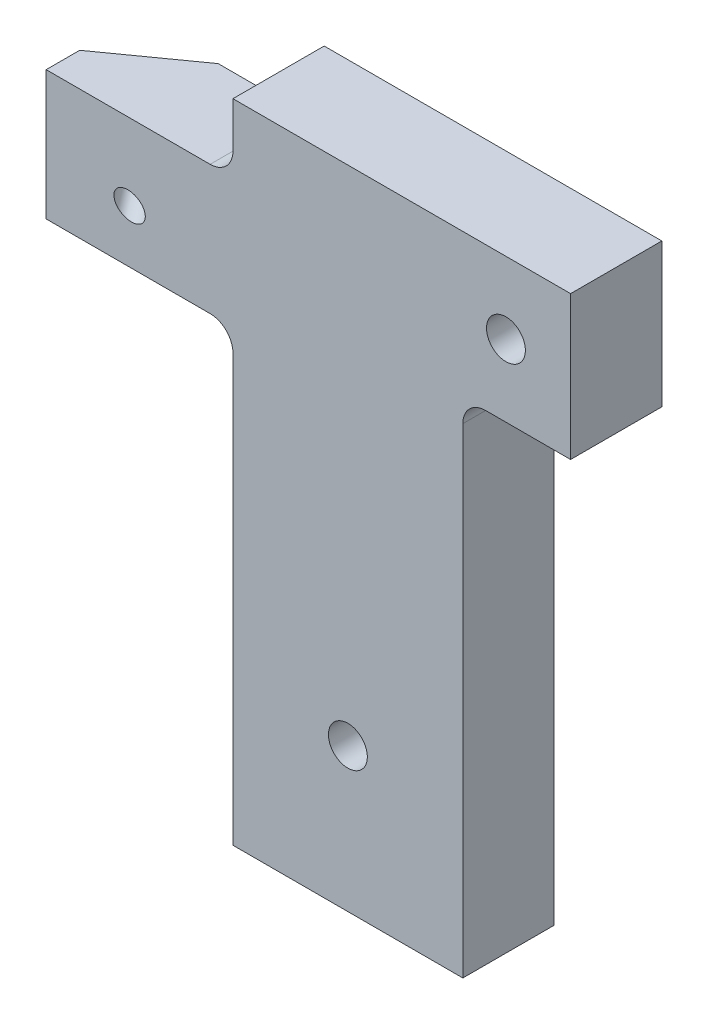
from build123d import *

# Parameters (mm, degrees)
SKETCH1_W                                      = 36.5
SKETCH1_H                                      = 45
BOSS_EXTRUDE1_DEPTH                            = 6.35
SKETCH4_W                                      = 50
SKETCH4_H                                      = 50
CUT_EXTRUDE1_DEPTH                             = 4
CUT_EXTRUDE2_DEPTH                             = 19
F_2_56_TAPPED_HOLE1_D                          = 1.778
CBORE_FOR_2_SOCKET_HEAD_CAP_SCREW1_D           = 2.7051
CBORE_FOR_2_SOCKET_HEAD_CAP_SCREW1_CBORE_D     = 4.7625
CBORE_FOR_2_SOCKET_HEAD_CAP_SCREW1_CBORE_DEPTH = 2.18439746


with BuildPart() as part:
    # Sketch1 → Boss-Extrude1 (new body)
    with BuildSketch(Plane.XY):
        with Locations((18.25, 22.5)):
            Rectangle(SKETCH1_W, SKETCH1_H)
    extrude(amount=BOSS_EXTRUDE1_DEPTH)

    # Sketch4 → Cut-Extrude1 (cut)
    with BuildSketch(Plane(origin=(-4.216220414, 1.201768304, -5.904135163), x_dir=(-0.8167793085195891, -0.191151005811028, 0.544364633450497), z_dir=(-0.5733326533031481, 0.16341958970717324, -0.8028597052762777))):
        with Locations((-8.601795261, 43.553754656)):
            Rectangle(SKETCH4_W, SKETCH4_H)
    extrude(amount=-CUT_EXTRUDE1_DEPTH, mode=Mode.SUBTRACT)

    # Sketch7 → Cut-Extrude2 (cut)
    with BuildSketch(Plane(origin=(0, 0, 0), x_dir=(-1, 0, 0), z_dir=(0, 0, -1))):
        with BuildLine():
            Line((0, 0), (-13, 0))
            Line((-13, 0), (-13, 29.6625))
            ThreePointArc((-13, 29.6625), (-12.535032015, 30.785032015), (-11.4125, 31.25))
            Line((-11.4125, 31.25), (0, 31.25))
            Line((0, 31.25), (0, 0))
        make_face()
        with BuildLine():
            Line((-36.5, 0), (-29, 0))
            Line((-29, 0), (-29, 33.4125))
            ThreePointArc((-29, 33.4125), (-29.464967985, 34.535032015), (-30.5875, 35))
            Line((-30.5875, 35), (-36.5, 35))
            Line((-36.5, 35), (-36.5, 0))
        make_face()
        with BuildLine():
            Line((-13, 45), (-13, 41.8375))
            ThreePointArc((-13, 41.8375), (-12.535032015, 40.714967985), (-11.4125, 40.25))
            Line((-11.4125, 40.25), (0, 40.25))
            Line((0, 40.25), (0, 45))
            Line((0, 45), (-13, 45))
        make_face()
    extrude(amount=-CUT_EXTRUDE2_DEPTH, mode=Mode.SUBTRACT)

    # #2-56 Tapped Hole1 (through all)
    with Locations(Plane(origin=(-1.9228898, 0.548089945, -2.692696342), x_dir=(-0.8167793085195892, -0.1911510058110318, 0.5443646334504959), z_dir=(-0.5733326533031478, 0.16341958970717313, -0.8028597052762778))):
        with Locations((-7.966944936, 34.99181106)):
            Hole(F_2_56_TAPPED_HOLE1_D / 2)

    # CBORE for #2 Socket Head Cap Screw1 (through all)
    with Locations(Plane(origin=(0, 0, 0), x_dir=(-1, 0, 0), z_dir=(0, 0, -1))):
        with Locations((-21, 10), (-32, 40)):
            CounterBoreHole(CBORE_FOR_2_SOCKET_HEAD_CAP_SCREW1_D / 2, CBORE_FOR_2_SOCKET_HEAD_CAP_SCREW1_CBORE_D / 2, CBORE_FOR_2_SOCKET_HEAD_CAP_SCREW1_CBORE_DEPTH)


solid = part.part
